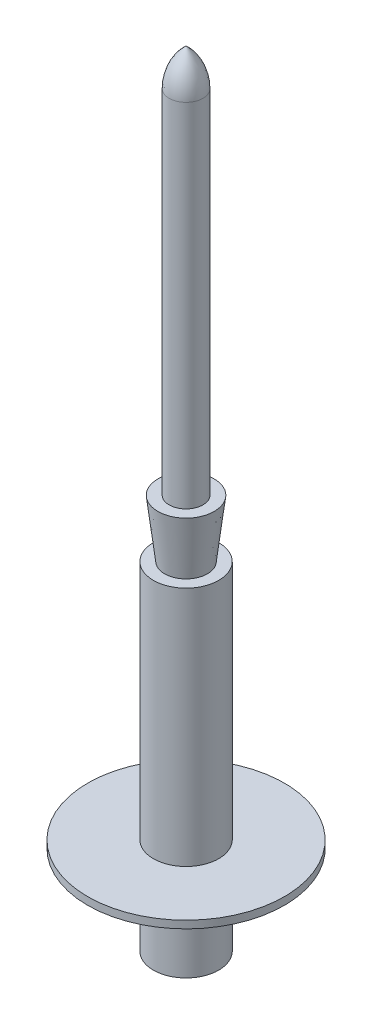
from build123d import *


with BuildPart() as part:
    # Sketch1 → Revolve1 (revolve)
    with BuildSketch(Plane.XY):
        with BuildLine():
            Line((0, 0), (2.9, 0))
            Line((2.9, 0), (2.9, 7.9))
            Line((2.9, 7.9), (8.732864907, 7.9))
            Line((8.732864907, 7.9), (8.732864907, 8.57))
            Line((8.732864907, 8.57), (2.9, 8.57))
            Line((2.9, 8.57), (2.9, 29.97))
            Line((2.9, 29.97), (1.9, 29.97))
            Line((1.9, 29.97), (2.5, 35.07))
            Line((2.5, 35.07), (1.5, 35.07))
            Line((1.5, 35.07), (1.5, 66.323834281))
            ThreePointArc((1.5, 66.323834281), (1.107157772, 68.124815809), (0, 69.598607228))
            Line((0, 69.598607228), (0, 0))
        make_face()
    revolve(axis=Axis((0, 69.598607228, 0), (0, -1, 0)))


solid = part.part
